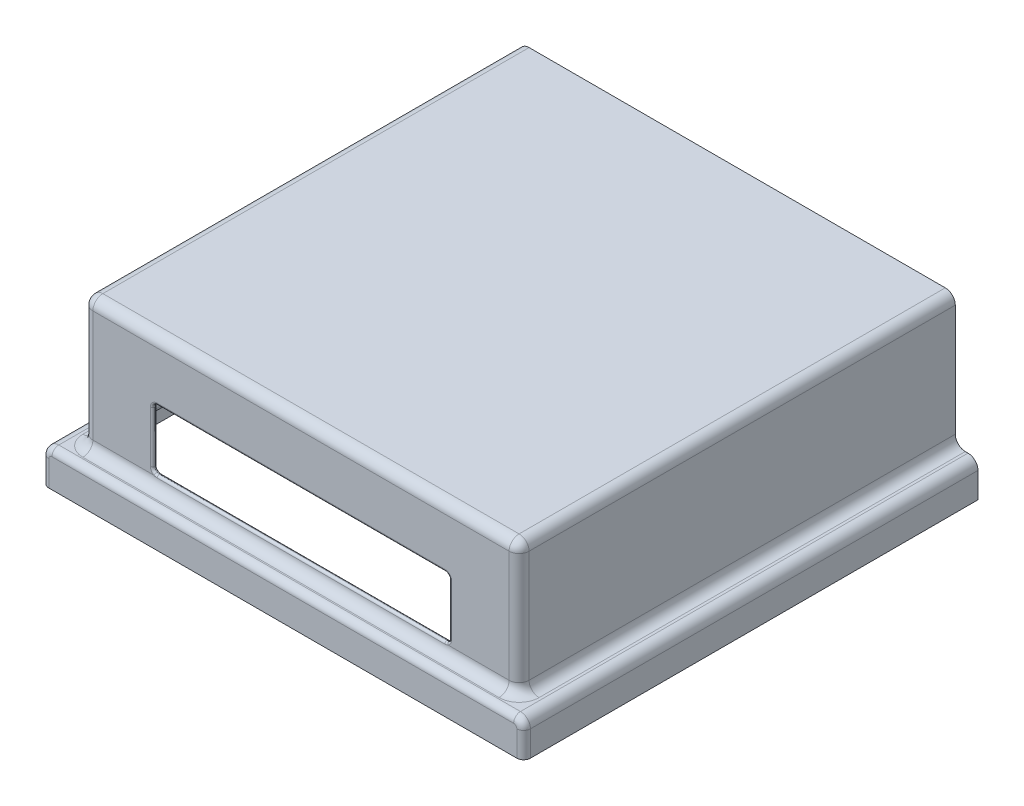
from build123d import *

# Parameters (mm, degrees)
SKETCH1_W            = 243.84
SKETCH1_H            = 241.3
BOSS_EXTRUDE1_DEPTH  = 2.54
SKETCH2_W            = 241.3
SKETCH2_H            = 76.2
BOSS_EXTRUDE2_DEPTH  = 2.54
SKETCH3_W            = 243.84
SKETCH3_H            = 76.2
BOSS_EXTRUDE3_DEPTH  = 2.54
SKETCH6_W            = 165.862
SKETCH6_H            = 33.782
CUT_EXTRUDE3_DEPTH   = 2.54
SKETCH22_W           = 12.7
SKETCH22_H           = 243.84
BOSS_EXTRUDE8_DEPTH  = 2.54
SKETCH24_W           = 3.048
SKETCH24_H           = 243.84
BOSS_EXTRUDE10_DEPTH = 19.812
SKETCH27_W           = 269.24
SKETCH27_H           = 19.812
BOSS_EXTRUDE11_DEPTH = 12.7
SKETCH28_W           = 263.144
SKETCH28_H           = 17.272
CUT_EXTRUDE6_DEPTH   = 9.652
FILLET4_R            = 5.588
FILLET5_R            = 2.54
FILLET6_R            = 3.81
FILLET7_R            = 2.54
FILLET8_R            = 1.27


with BuildPart() as part:
    # Sketch1 → Boss-Extrude1 (new body)
    with BuildSketch(Plane(origin=(0, 0, 0), x_dir=(1, 0, 0), z_dir=(0, 1, 0))):
        Rectangle(SKETCH1_W, SKETCH1_H)
    extrude(amount=BOSS_EXTRUDE1_DEPTH)

    # Sketch2 → Boss-Extrude2 (add)
    with BuildSketch(Plane(origin=(121.92, 0, 0), x_dir=(0, 0, -1), z_dir=(1, 0, 0))):
        with Locations((0, -35.56)):
            Rectangle(SKETCH2_W, SKETCH2_H)
    boss_extrude2 = extrude(amount=-BOSS_EXTRUDE2_DEPTH)

    # Sketch3 → Boss-Extrude3 (add)
    with BuildSketch(Plane.XY.offset(120.65)):
        with Locations((0, -35.56)):
            Rectangle(SKETCH3_W, SKETCH3_H)
    extrude(amount=BOSS_EXTRUDE3_DEPTH)

    # Sketch6 → Cut-Extrude3 (cut)
    with BuildSketch(Plane.XY.offset(123.19)):
        with Locations((0, -47.879)):
            Rectangle(SKETCH6_W, SKETCH6_H)
    extrude(amount=-CUT_EXTRUDE3_DEPTH, mode=Mode.SUBTRACT)

    # Mirror15: Boss-Extrude2 across plane
    add(boss_extrude2.mirror(Plane.ZY))


with BuildPart() as body_2:
    # Sketch22 → Boss-Extrude8 (new body)
    with BuildSketch(Plane(origin=(0, -71.12, 0), x_dir=(-1, 0, 0), z_dir=(0, -1, 0))):
        with Locations((-128.27, -1.27)):
            Rectangle(SKETCH22_W, SKETCH22_H)
    boss_extrude8 = extrude(amount=BOSS_EXTRUDE8_DEPTH)

    # Sketch24 → Boss-Extrude10 (add)
    with BuildSketch(Plane(origin=(0, -71.12, 0), x_dir=(1, 0, 0), z_dir=(0, 1, 0))):
        with Locations((133.096, -1.27)):
            Rectangle(SKETCH24_W, SKETCH24_H)
    boss_extrude10 = extrude(amount=-BOSS_EXTRUDE10_DEPTH)


with BuildPart() as part_1:
    add(part.part)

    # Mirror18: Boss-Extrude8, Boss-Extrude10 across plane
    add(boss_extrude8.mirror(Plane.ZY))
    add(boss_extrude10.mirror(Plane.ZY))

    add(body_2.part)  # Boss-Extrude11 merges body 2
    # Sketch27 → Boss-Extrude11 (add)
    with BuildSketch(Plane.XY.offset(120.65)):
        with Locations((0, -81.026)):
            Rectangle(SKETCH27_W, SKETCH27_H)
    extrude(amount=BOSS_EXTRUDE11_DEPTH)

    # Sketch28 → Cut-Extrude6 (cut)
    with BuildSketch(Plane(origin=(0, 0, 120.65), x_dir=(-1, 0, 0), z_dir=(0, 0, -1))):
        with Locations((0, -82.296)):
            Rectangle(SKETCH28_W, SKETCH28_H)
    extrude(amount=-CUT_EXTRUDE6_DEPTH, mode=Mode.SUBTRACT)

    # Fillet4
    fillet4_edges = [part_1.edges().sort_by_distance(p)[0] for p in [
        (-121.92, -71.12, 1.27),
        (-121.92, 2.54, 1.27),
        (0, -71.12, 123.19),
        (0, 2.54, 123.19),
        (-134.62, -71.12, 6.35),
        (134.62, -71.12, 6.35),
        (0, -73.66, 130.302),
        (121.92, -71.12, 1.27),
        (121.92, 2.54, 1.27),
        (121.92, -34.29, 123.19),
        (-121.92, -34.29, 123.19),
    ]]
    fillet(fillet4_edges, radius=FILLET4_R)

    # Fillet5
    fillet5_edges = [part_1.edges().sort_by_distance(p)[0] for p in [
        (-131.572, -85.09, 130.302),
        (0, -73.66, 120.65),
        (131.572, -85.09, 130.302),
        (131.572, -73.66, 2.032),
        (131.572, -75.296687307, 128.665312693),
        (-131.572, -73.66, 2.032),
        (-131.572, -75.296687307, 128.665312693),
        (119.38, -36.83, 120.65),
        (-119.38, -36.83, 120.65),
        (0, 0, 120.65),
        (119.38, -73.66, 0),
        (119.38, 0, 0),
        (-119.38, 0, 0),
        (-119.38, -73.66, 0),
    ]]
    fillet(fillet5_edges, radius=FILLET5_R)

    # Fillet6
    fillet6_edges = [part_1.edges().sort_by_distance(p)[0] for p in [
        (0, -71.12, 133.35),
        (-134.62, -83.82, 133.35),
        (132.983312693, -72.756687307, 133.35),
        (-132.983312693, -72.756687307, 133.35),
        (134.62, -83.82, 133.35),
    ]]
    fillet(fillet6_edges, radius=FILLET6_R)

    # Fillet7
    fillet7_edges = [part_1.edges().sort_by_distance(p)[0] for p in [
        (82.931, -64.77, 121.92),
        (-82.931, -64.77, 121.92),
        (-82.931, -30.988, 121.92),
        (82.931, -30.988, 121.92),
    ]]
    fillet(fillet7_edges, radius=FILLET7_R)

    # Fillet8
    fillet8_edges = [part_1.edges().sort_by_distance(p)[0] for p in [
        (-82.187051224, -31.731948776, 120.65),
        (0, -30.988, 120.65),
        (82.187051224, -31.731948776, 120.65),
        (82.931, -47.879, 120.65),
        (82.187051224, -64.026051224, 120.65),
        (0, -64.77, 120.65),
        (-82.187051224, -64.026051224, 120.65),
        (-82.187051224, -31.731948776, 123.19),
        (0, -30.988, 123.19),
        (82.187051224, -31.731948776, 123.19),
        (82.931, -47.879, 123.19),
        (82.187051224, -64.026051224, 123.19),
        (0, -64.77, 123.19),
        (-82.187051224, -64.026051224, 123.19),
        (-82.931, -47.879, 120.65),
        (-82.931, -47.879, 123.19),
    ]]
    fillet(fillet8_edges, radius=FILLET8_R - 0.0001)  # a hair under: the kernel refuses the full size


solid = part_1.part
